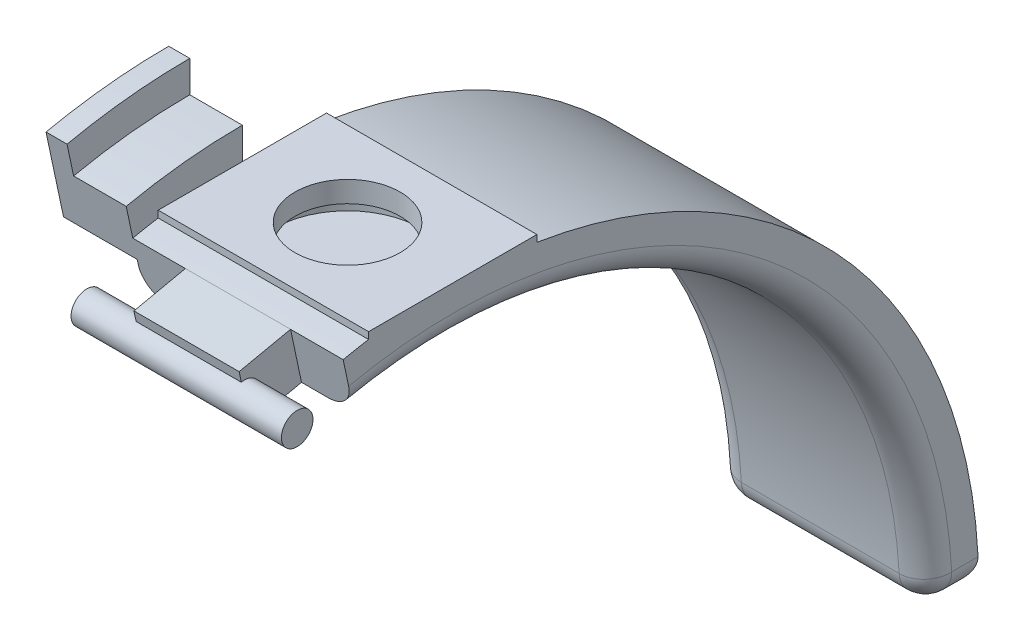
from build123d import *

# Parameters (mm, degrees)
BOSS_EXTRUDE1_DEPTH = 20
BOSS_EXTRUDE2_DEPTH = 20
SKETCH4_R           = 5
CUT_EXTRUDE1_DEPTH  = 2
SKETCH5_R           = 7
CUT_EXTRUDE2_DEPTH  = 2
BOSS_EXTRUDE5_DEPTH = 5
BOSS_EXTRUDE6_DEPTH = 2
SKETCH11_W          = 20
SKETCH11_H          = 5
SKETCH12_W          = 5
SKETCH12_H          = 5
BOSS_EXTRUDE7_DEPTH = 5
SKETCH13_R          = 1.5
BOSS_EXTRUDE8_DEPTH = 5
FILLET1_R           = 2.5


with BuildPart() as part:
    # Sketch2 → Boss-Extrude1 (new body)
    with BuildSketch(Plane(origin=(0, 0, 0), x_dir=(0, 0, -1), z_dir=(1, 0, 0))):
        with BuildLine():
            Line((-50, 0), (-45, 0))
            ThreePointArc((-45, 0), (0, 45), (45, 0))
            Line((45, 0), (50, 0))
            ThreePointArc((50, 0), (0, 50), (-50, 0))
        make_face()
    extrude(amount=BOSS_EXTRUDE1_DEPTH)

    # Sketch3 → Boss-Extrude2 (add)
    with BuildSketch(Plane(origin=(0, 0, 0), x_dir=(0, 0, -1), z_dir=(1, 0, 0))):
        Polygon((0, 45), (8, 45), (8, 50), (-8, 50), (-8, 45), align=None)
    extrude(amount=BOSS_EXTRUDE2_DEPTH)

    # Sketch4 → Cut-Extrude1 (cut)
    with BuildSketch(Plane(origin=(0, 50, 0), x_dir=(1, 0, 0), z_dir=(0, 1, 0))):
        with Locations(Location((10, 0, 0), (0, 0, 270))):
            Circle(SKETCH4_R)
    extrude(amount=-CUT_EXTRUDE1_DEPTH, mode=Mode.SUBTRACT)

    # Sketch5 → Cut-Extrude2 (cut)
    with BuildSketch(Plane(origin=(0, 48, 0), x_dir=(1, 0, 0), z_dir=(0, 1, 0))):
        with Locations(Location((10, 0, 0), (0, 0, 270))):
            Circle(SKETCH5_R)
    extrude(amount=-CUT_EXTRUDE2_DEPTH, mode=Mode.SUBTRACT)

    # Sketch9 → Boss-Extrude5 (add)
    with BuildSketch(Plane.ZY):
        with BuildLine():
            Line((10, 46.946778377), (11.041666667, 51.837067792))
            ThreePointArc((11.041666667, 51.837067792), (5.551369518, 52.708465131), (0, 53))
            Line((0, 53), (0, 48))
            ThreePointArc((0, 48), (5.027655412, 47.735968421), (10, 46.946778377))
        make_face()
    extrude(amount=BOSS_EXTRUDE5_DEPTH)

    # Sketch10 → Boss-Extrude6 (add)
    with BuildSketch(Plane.ZY.offset(5)):
        with BuildLine():
            Line((10, 46.946778377), (11.666666667, 54.77124144))
            ThreePointArc((11.666666667, 54.77124144), (5.865597981, 55.691963157), (0, 56))
            Line((0, 56), (0, 48))
            ThreePointArc((0, 48), (5.027655412, 47.735968421), (10, 46.946778377))
        make_face()
    extrude(amount=BOSS_EXTRUDE6_DEPTH)

    # Cut-Sweep2: sweep along a curve in space
    with BuildLine() as cut_sweep2_path:
        ThreePointArc((0, 48.902894143, 10.416666667), (0, 31.45764348, 38.864079388), (0, 0, 50))
    # Sketch11 → Cut-Sweep2 (sweep, cut)
    with BuildSketch(Plane.XZ):
        with Locations((10, 47.5)):
            Rectangle(SKETCH11_W, SKETCH11_H)
    sweep(path=cut_sweep2_path.line, mode=Mode.SUBTRACT)

    # Sketch12 → Boss-Extrude7 (add)
    with BuildSketch(Plane(origin=(0, 0, 0), x_dir=(1, 0, 0), z_dir=(0, -0.20833333333333337, 0.9780578828587918))):
        with Locations((7.5, 47.5)):
            Rectangle(SKETCH12_W, SKETCH12_H)
    boss_extrude7 = extrude(amount=BOSS_EXTRUDE7_DEPTH)

    # Sketch13 → Boss-Extrude8 (add, symmetric)
    with BuildSketch(Plane.ZY.offset(-5)):
        with Locations((14.786122748, 45.416082769)):
            Circle(SKETCH13_R)
    boss_extrude8 = extrude(amount=BOSS_EXTRUDE8_DEPTH, both=True)

    # Mirror1: Boss-Extrude7, Boss-Extrude8 across plane
    add(boss_extrude7.mirror(Plane(origin=(10, 42.970938062, 14.265289414), x_dir=(0, 0, 1), z_dir=(-1, 0, 0))))
    add(boss_extrude8.mirror(Plane(origin=(10, 42.970938062, 14.265289414), x_dir=(0, 0, 1), z_dir=(-1, 0, 0))))

    # Fillet1
    fillet1_edges = [part.edges().sort_by_distance(p)[0] for p in [
        (10, 0, -45),
        (20, 0, -47.5),
        (10, 0, -50),
        (0, 0, -47.5),
        (0, 34.977671449, -28.311879132),
        (20, 34.977671449, -28.311879132),
    ]]
    fillet(fillet1_edges, radius=FILLET1_R - 0.0001)  # a hair under: the kernel refuses the full size


solid = part.part
